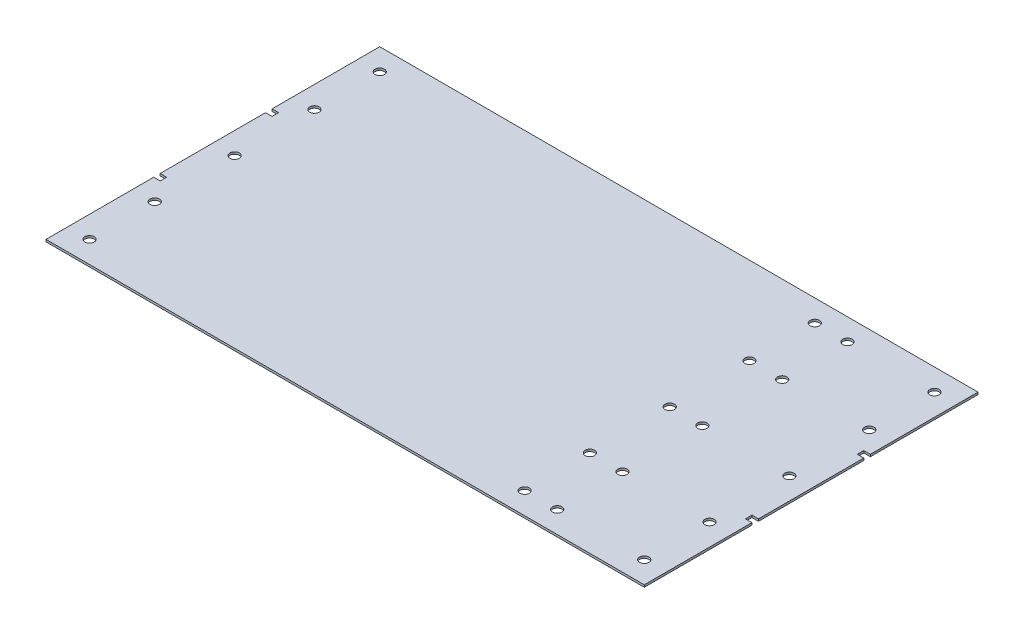
from build123d import *

# Parameters (mm, degrees)
SKETCH1_R           = 2.15
BOSS_EXTRUDE1_DEPTH = 1


with BuildPart() as part:
    # Sketch1 → Boss-Extrude1 (new body)
    with BuildSketch(Plane(origin=(0, 0, 0), x_dir=(1, 0, 0), z_dir=(0, 1, 0))):
        Polygon((-7, -27.2), (-10, -27.2), (-10, -76.7), (265, -76.7), (265, -27.2), (262, -27.2), (262, -24.2), (265, -24.2), (265, 24.2), (262, 24.2), (262, 27.2), (265, 27.2), (265, 76.7), (-10, 76.7), (-10, 27.2), (-7, 27.2), (-7, 24.2), (-10, 24.2), (-10, -24.2), (-7, -24.2), align=None)
        with Locations((0, -66.7)):
            Circle(SKETCH1_R, mode=Mode.SUBTRACT)
        with Locations((0, -36.7)):
            Circle(SKETCH1_R, mode=Mode.SUBTRACT)
        Circle(SKETCH1_R, mode=Mode.SUBTRACT)
        with Locations((200, -66.7)):
            Circle(SKETCH1_R, mode=Mode.SUBTRACT)
        with Locations((215, -66.7)):
            Circle(SKETCH1_R, mode=Mode.SUBTRACT)
        with Locations((255, -66.7)):
            Circle(SKETCH1_R, mode=Mode.SUBTRACT)
        with Locations((200, -36.7)):
            Circle(SKETCH1_R, mode=Mode.SUBTRACT)
        with Locations((215, -36.7)):
            Circle(SKETCH1_R, mode=Mode.SUBTRACT)
        with Locations((255, -36.7)):
            Circle(SKETCH1_R, mode=Mode.SUBTRACT)
        with Locations((200, 0)):
            Circle(SKETCH1_R, mode=Mode.SUBTRACT)
        with Locations((215, 0)):
            Circle(SKETCH1_R, mode=Mode.SUBTRACT)
        with Locations((255, 0)):
            Circle(SKETCH1_R, mode=Mode.SUBTRACT)
        with Locations((0, 36.7)):
            Circle(SKETCH1_R, mode=Mode.SUBTRACT)
        with Locations((0, 66.7)):
            Circle(SKETCH1_R, mode=Mode.SUBTRACT)
        with Locations((200, 36.7)):
            Circle(SKETCH1_R, mode=Mode.SUBTRACT)
        with Locations((215, 36.7)):
            Circle(SKETCH1_R, mode=Mode.SUBTRACT)
        with Locations((255, 36.7)):
            Circle(SKETCH1_R, mode=Mode.SUBTRACT)
        with Locations((200, 66.7)):
            Circle(SKETCH1_R, mode=Mode.SUBTRACT)
        with Locations((215, 66.7)):
            Circle(SKETCH1_R, mode=Mode.SUBTRACT)
        with Locations((255, 66.7)):
            Circle(SKETCH1_R, mode=Mode.SUBTRACT)
    extrude(amount=BOSS_EXTRUDE1_DEPTH)


solid = part.part
